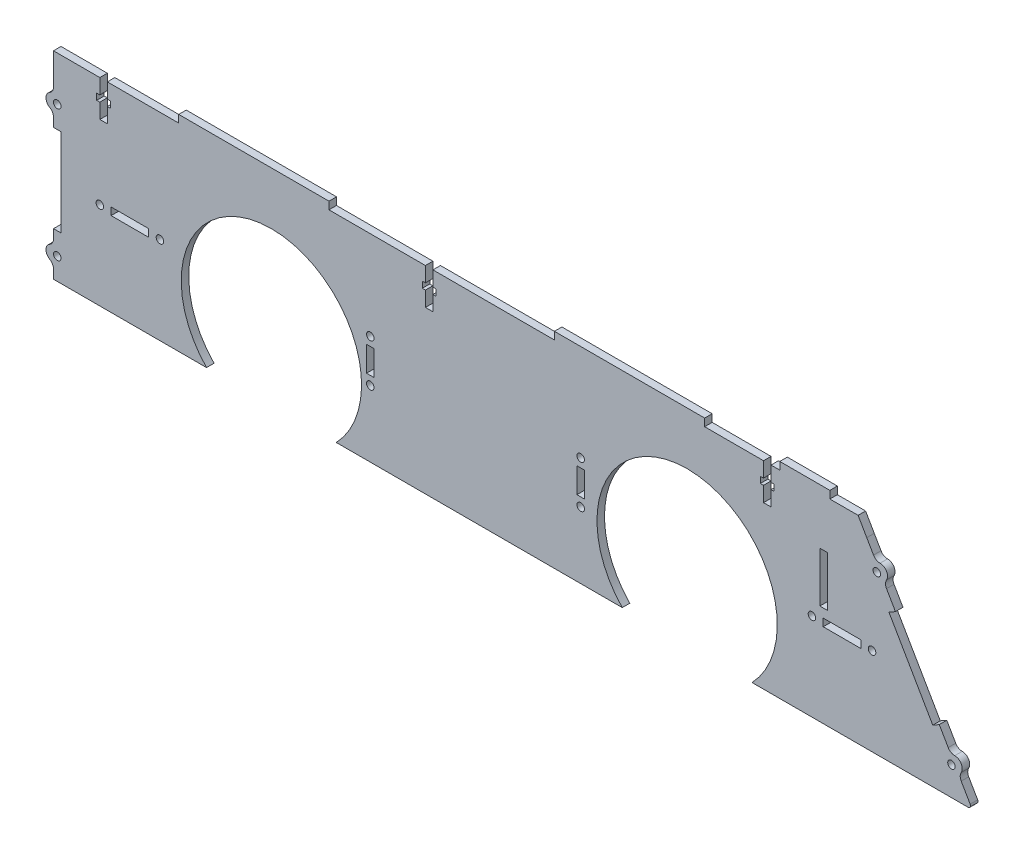
from build123d import *

# Parameters (mm, degrees)
EXTRUDE_1_DEPTH      = 3
SKETCH_2_W           = 3
SKETCH_2_H           = 35
CUT_EXTRUDE_1_DEPTH  = 3
CUT_EXTRUDE_2_DEPTH  = 3
SKETCH_4_W           = 3
SKETCH_4_H           = 10
CUT_EXTRUDE_3_DEPTH  = 3
SKETCH_5_W           = 15
SKETCH_5_H           = 3
CUT_EXTRUDE_4_DEPTH  = 3
SKETCH_6_W           = 324.73
SKETCH_6_H           = 3
EXTRUDE_2_DEPTH      = 6
SKETCH_8_W           = 3
SKETCH_8_H           = 3
SKETCH_9_W           = 3
SKETCH_9_H           = 3
SKETCH_7_R           = 1.5
CUT_EXTRUDE_6_DEPTH  = 3
FILLET_1_R           = 3
SKETCH_14_R          = 1.5
CUT_EXTRUDE_9_DEPTH  = 3
SKETCH_15_R          = 1.5
CUT_EXTRUDE_10_DEPTH = 3
SKETCH_16_W          = 3
SKETCH_16_H          = 3
SKETCH_17_W          = 3
SKETCH_17_H          = 3
SKETCH_18_R          = 1.5
CUT_EXTRUDE_11_DEPTH = 3
FILLET_2_R           = 3
CHAMFER_1_SIZE2      = 3.464101615
CHAMFER_1_SIZE       = 6
SKETCH_19_R          = 36
CUT_EXTRUDE_12_DEPTH = 3
SKETCH_24_W          = 20
SKETCH_24_H          = 3
SKETCH_24_W_2        = 60
EXTRUDE_3_DEPTH      = 3
CUT_EXTRUDE_13_DEPTH = 3
FILLET_3_R           = 1
SKETCH_26_W          = 3
SKETCH_26_H          = 20
CUT_EXTRUDE_14_DEPTH = 3


with BuildPart() as part:
    # Эскиз1 → Бобышка-Вытянуть1 (new body)
    with BuildSketch(Plane.XY):
        Polygon((-42.146569651, 73), (0, 0), (-366.876569651, 0), (-366.876569651, 73), align=None)
    extrude(amount=EXTRUDE_1_DEPTH)

    # Эскиз2 → Вырез-Вытянуть1 (cut)
    with BuildSketch(Plane.XY.offset(3)):
        with Locations((-365.376569651, 35)):
            Rectangle(SKETCH_2_W, SKETCH_2_H)
    extrude(amount=-CUT_EXTRUDE_1_DEPTH, mode=Mode.SUBTRACT)

    # Эскиз3 → Вырез-Вытянуть2 (cut)
    with BuildSketch(Plane.XY.offset(3)):
        Polygon((-33.287386441, 51.655444566), (-30.689310229, 53.155444566), (-13.189310229, 22.844555434), (-15.787386441, 21.344555434), align=None)
    extrude(amount=-CUT_EXTRUDE_2_DEPTH, mode=Mode.SUBTRACT)

    # Эскиз4 → Вырез-Вытянуть3 (cut)
    with BuildSketch(Plane.XY.offset(3)):
        with Locations((-240.376569651, 35)):
            Rectangle(SKETCH_4_W, SKETCH_4_H)
        with Locations((-156.376569651, 35)):
            Rectangle(SKETCH_4_W, SKETCH_4_H)
    extrude(amount=-CUT_EXTRUDE_3_DEPTH, mode=Mode.SUBTRACT)

    # Эскиз5 → Вырез-Вытянуть4 (cut)
    with BuildSketch(Plane.XY.offset(3)):
        with Locations((-336.376569651, 35)):
            Rectangle(SKETCH_5_W, SKETCH_5_H)
        with Locations((-52.036569651, 35)):
            Rectangle(SKETCH_5_W, SKETCH_5_H)
    extrude(amount=-CUT_EXTRUDE_4_DEPTH, mode=Mode.SUBTRACT)

    # Эскиз6 → Бобышка-Вытянуть2 (add)
    with BuildSketch(Plane(origin=(0, 73, 0), x_dir=(1, 0, 0), z_dir=(0, 1, 0))):
        with Locations((-204.511569651, -1.5)):
            Rectangle(SKETCH_6_W, SKETCH_6_H)
    extrude(amount=EXTRUDE_2_DEPTH)

    # Эскиз8 → Повернуть1 (revolve)
    with BuildSketch(Plane.ZY.offset(366.876569651)):
        with Locations((1.5, 7.25)):
            Rectangle(SKETCH_8_W, SKETCH_8_H)
    revolve(axis=Axis((-366.876569651, 8.75, 0), (0, 0, 1)))

    # Эскиз9 → Повернуть2 (revolve)
    with BuildSketch(Plane.ZY.offset(366.876569651)):
        with Locations((1.5, 59.75)):
            Rectangle(SKETCH_9_W, SKETCH_9_H)
    revolve(axis=Axis((-366.876569651, 61.25, 0), (0, 0, 1)))

    # Эскиз7 → Вырез-Вытянуть6 (cut)
    with BuildSketch(Plane.XY.offset(3)):
        with Locations((-365.376569651, 8.75)):
            Circle(SKETCH_7_R)
        with Locations(Location((-365.376569651, 61.25, 0), (0, 0, 180))):
            Circle(SKETCH_7_R)
    extrude(amount=-CUT_EXTRUDE_6_DEPTH, mode=Mode.SUBTRACT)

    # Скругление1
    fillet_1_edges = [part.edges().sort_by_distance(p)[0] for p in [
        (-366.876569651, 5.75, 1.5),
        (-366.876569651, 11.75, 1.5),
        (-366.876569651, 58.25, 1.5),
        (-366.876569651, 64.25, 1.5),
    ]]
    fillet(fillet_1_edges, radius=FILLET_1_R)

    # Эскиз14 → Вырез-Вытянуть9 (cut)
    with BuildSketch(Plane.XY.offset(3)):
        with Locations((-156.376569651, 43.5)):
            Circle(SKETCH_14_R)
        with Locations((-156.376569651, 26.5)):
            Circle(SKETCH_14_R)
        with Locations((-240.376569651, 26.5)):
            Circle(SKETCH_14_R)
        with Locations((-240.376569651, 43.5)):
            Circle(SKETCH_14_R)
    extrude(amount=-CUT_EXTRUDE_9_DEPTH, mode=Mode.SUBTRACT)

    # Эскиз15 → Вырез-Вытянуть10 (cut)
    with BuildSketch(Plane.XY.offset(3)):
        with Locations((-324.376569651, 35)):
            Circle(SKETCH_15_R)
        with Locations((-348.376569651, 35)):
            Circle(SKETCH_15_R)
        with Locations((-64.036569651, 35)):
            Circle(SKETCH_15_R)
        with Locations((-40.036569651, 35)):
            Circle(SKETCH_15_R)
    extrude(amount=-CUT_EXTRUDE_10_DEPTH, mode=Mode.SUBTRACT)

    # Эскиз16 → Повернуть3 (revolve)
    with BuildSketch(Plane(origin=(0, 0, 0), x_dir=(0, 0, -1), z_dir=(0.8660254037844265, 0.5000000000000212, 0))):
        with Locations((-1.5, 12.558620458)):
            Rectangle(SKETCH_16_W, SKETCH_16_H)
    revolve(axis=Axis((-7.029310229, 12.175122459, 3), (0, 0, -1)))

    # Эскиз17 → Повернуть4 (revolve)
    with BuildSketch(Plane(origin=(0, 0, 0), x_dir=(0, 0, -1), z_dir=(0.8660254037844265, 0.5000000000000212, 0))):
        with Locations((-1.5, 75.198620458)):
            Rectangle(SKETCH_17_W, SKETCH_17_H)
    revolve(axis=Axis((-36.849310229, 63.824877541, 3), (0, 0, -1)))

    # Эскиз18 → Вырез-Вытянуть11 (cut)
    with BuildSketch(Plane.XY.offset(3)):
        with Locations((-38.149990748, 63.077722283)):
            Circle(SKETCH_18_R)
        with Locations((-8.326705922, 11.422277717)):
            Circle(SKETCH_18_R)
    extrude(amount=-CUT_EXTRUDE_11_DEPTH, mode=Mode.SUBTRACT)

    # Скругление2
    fillet_2_edges = [part.edges().sort_by_distance(p)[0] for p in [
        (-5.529310229, 9.577046248, 1.5),
        (-8.529310229, 14.773198671, 1.5),
        (-35.349310229, 61.226801329, 1.5),
        (-38.349310229, 66.422953752, 1.5),
    ]]
    fillet(fillet_2_edges, radius=FILLET_2_R)

    # Фаска1
    chamfer_1_edges = [part.edges().sort_by_distance(p)[0] for p in [
        (-42.146569651, 79, 1.5),
    ]]
    chamfer_1_side = [part.faces().sort_by_distance(p)[0] for p in [
        (-42.146569651, 78.930717968, 1.5),
    ]]
    chamfer(chamfer_1_edges, length=CHAMFER_1_SIZE - 0.0001, length2=CHAMFER_1_SIZE2 - 0.0001, reference=chamfer_1_side[0])  # a hair under: the kernel refuses the full size

    # Эскиз19 → Вырез-Вытянуть12 (cut)
    with BuildSketch(Plane.XY.offset(3)):
        with Locations((-279.876569651, 25)):
            Circle(SKETCH_19_R)
        with Locations((-113.876569651, 25)):
            Circle(SKETCH_19_R)
    extrude(amount=-CUT_EXTRUDE_12_DEPTH, mode=Mode.SUBTRACT)

    # Эскиз24 → Бобышка-Вытянуть3 (add)
    with BuildSketch(Plane(origin=(0, 79, 0), x_dir=(1, 0, 0), z_dir=(0, 1, 0))):
        with Locations((-66.876569651, -1.5)):
            Rectangle(SKETCH_24_W, SKETCH_24_H)
        with Locations((-136.876569651, -1.5)):
            Rectangle(SKETCH_24_W_2, SKETCH_24_H)
        with Locations((-286.876569651, -1.5)):
            Rectangle(SKETCH_24_W_2, SKETCH_24_H)
    extrude(amount=EXTRUDE_3_DEPTH)

    # Эскиз25 → Вырез-Вытянуть13 (cut)
    with BuildSketch(Plane.XY.offset(3)):
        Polygon((-348.376569651, 79), (-348.376569651, 73), (-349.626569651, 73), (-349.626569651, 70.5), (-348.376569651, 70.5), (-348.376569651, 64.5), (-345.376569651, 64.5), (-345.376569651, 70.5), (-344.126569651, 70.5), (-344.126569651, 73), (-345.376569651, 73), (-345.376569651, 79), align=None)
        Polygon((-218.376569651, 79), (-218.376569651, 73), (-219.626569651, 73), (-219.626569651, 70.5), (-218.376569651, 70.5), (-218.376569651, 64.5), (-215.376569651, 64.5), (-215.376569651, 70.5), (-214.126569651, 70.5), (-214.126569651, 73), (-215.376569651, 73), (-215.376569651, 79), align=None)
        Polygon((-83.376569651, 79), (-83.376569651, 73), (-84.626569651, 73), (-84.626569651, 70.5), (-83.376569651, 70.5), (-83.376569651, 64.5), (-80.376569651, 64.5), (-80.376569651, 70.5), (-79.126569651, 70.5), (-79.126569651, 73), (-80.376569651, 73), (-80.376569651, 79), align=None)
    extrude(amount=-CUT_EXTRUDE_13_DEPTH, mode=Mode.SUBTRACT)

    # Скругление3
    fillet_3_edges = [part.edges().sort_by_distance(p)[0] for p in [
        (0, 0, 1.5),
    ]]
    fillet(fillet_3_edges, radius=FILLET_3_R)

    # Эскиз26 → Вырез-Вытянуть14 (cut)
    with BuildSketch(Plane.XY.offset(3)):
        with Locations((-59.376569651, 50)):
            Rectangle(SKETCH_26_W, SKETCH_26_H)
    extrude(amount=-CUT_EXTRUDE_14_DEPTH, mode=Mode.SUBTRACT)


solid = part.part
